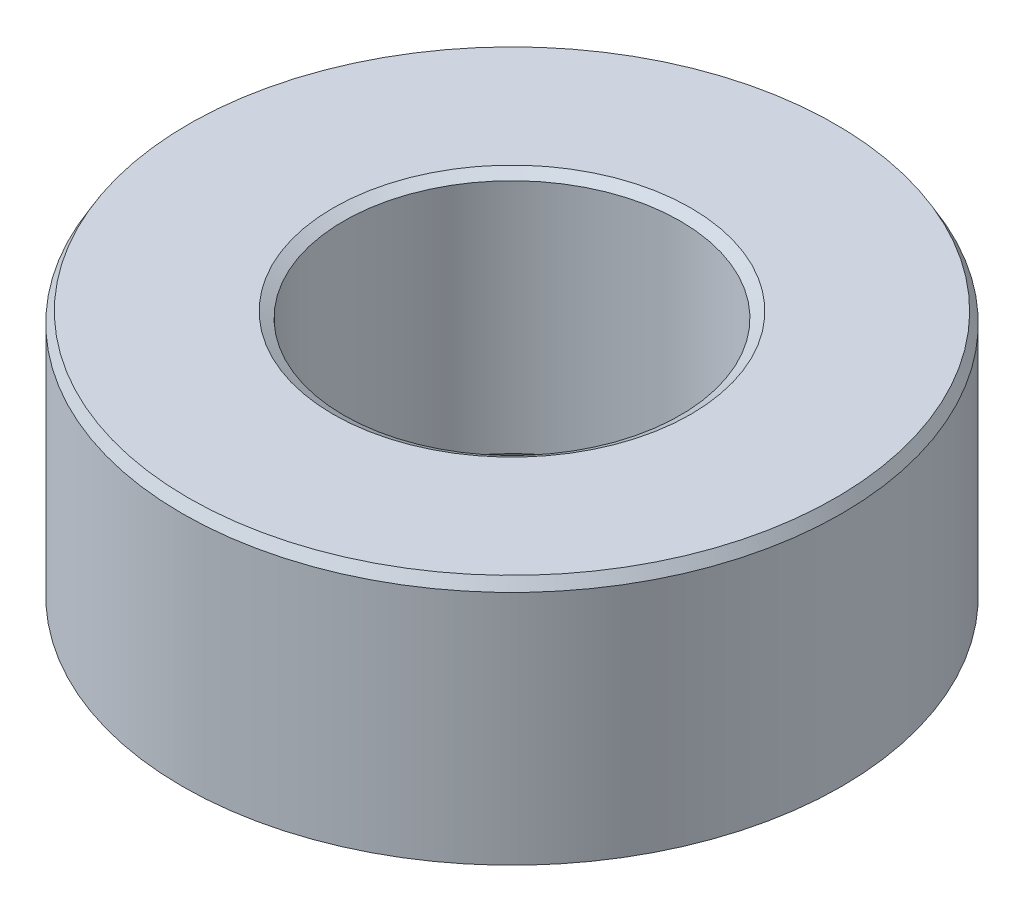
from build123d import *
from OCP.BRepFilletAPI import BRepFilletAPI_MakeChamfer

# Parameters (mm, degrees)
SKETCH1_R           = 10
BOSS_EXTRUDE1_DEPTH = 7.669356633
SKETCH2_R           = 5.10406272
CUT_EXTRUDE1_DEPTH  = 17.087853529
CHAMFER1_SIZE       = 0.319401157
CHAMFER1_SIZE2      = 0.184406344


with BuildPart() as part:
    # Sketch1 → Boss-Extrude1 (new body)
    with BuildSketch(Plane(origin=(0, 0, 0), x_dir=(1, 0, 0), z_dir=(0, 1, 0))):
        Circle(SKETCH1_R)
    extrude(amount=BOSS_EXTRUDE1_DEPTH)

    # Sketch2 → Cut-Extrude1 (cut, through all)
    with BuildSketch(Plane(origin=(0, 0, 0), x_dir=(1, 0, 0), z_dir=(0, 1, 0))):
        Circle(SKETCH2_R)
    extrude(amount=CUT_EXTRUDE1_DEPTH, mode=Mode.SUBTRACT)

    # Chamfer1: one chamfer whose edges measure the first distance from different faces: ONE call of the kernel's chamfer builder (chamfer() names one face for all edges)
    chamfer1_edges_1 = [part.edges().sort_by_distance(p)[0] for p in [
        (-5.10406272, 7.669356633, 0),
    ]]
    chamfer1_side_1 = [part.faces().sort_by_distance(p)[0] for p in [
        (-9.717157288, 7.669356633, 0),
    ]]
    chamfer1_edges_2 = [part.edges().sort_by_distance(p)[0] for p in [
        (-5.10406272, 0, 0),
    ]]
    chamfer1_side_2 = [part.faces().sort_by_distance(p)[0] for p in [
        (-5.10406272, 3.834678317, 0),
    ]]
    chamfer1_edges_3 = [part.edges().sort_by_distance(p)[0] for p in [
        (-10, 0, 0),
    ]]
    chamfer1_side_3 = [part.faces().sort_by_distance(p)[0] for p in [
        (-9.717157288, 0, 0),
    ]]
    chamfer1_edges_4 = [part.edges().sort_by_distance(p)[0] for p in [
        (-10, 7.669356633, 0),
    ]]
    chamfer1_side_4 = [part.faces().sort_by_distance(p)[0] for p in [
        (-10, 3.834678317, 0),
    ]]
    chamfer1 = BRepFilletAPI_MakeChamfer(part.part.solid().wrapped)
    for e in chamfer1_edges_1:
        chamfer1.Add(CHAMFER1_SIZE, CHAMFER1_SIZE2, e.wrapped, chamfer1_side_1[0].wrapped)  # the first distance lies on this face
    for e in chamfer1_edges_2:
        chamfer1.Add(CHAMFER1_SIZE, CHAMFER1_SIZE2, e.wrapped, chamfer1_side_2[0].wrapped)  # the first distance lies on this face
    for e in chamfer1_edges_3:
        chamfer1.Add(CHAMFER1_SIZE, CHAMFER1_SIZE2, e.wrapped, chamfer1_side_3[0].wrapped)  # the first distance lies on this face
    for e in chamfer1_edges_4:
        chamfer1.Add(CHAMFER1_SIZE, CHAMFER1_SIZE2, e.wrapped, chamfer1_side_4[0].wrapped)  # the first distance lies on this face
    add(Compound.cast(chamfer1.Shape()), mode=Mode.REPLACE)


solid = part.part
